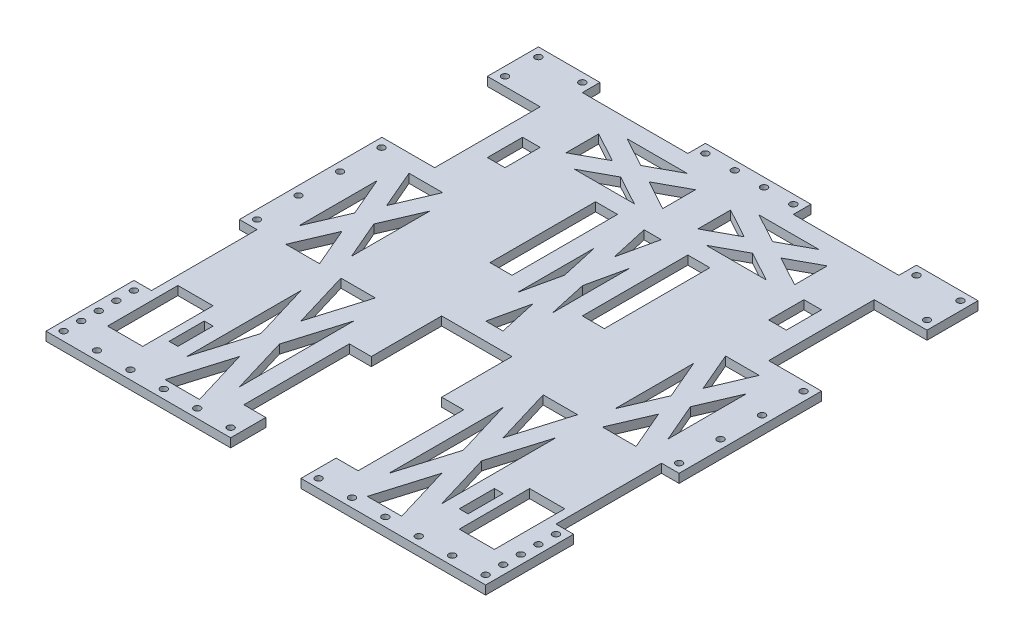
from build123d import *

# Parameters (mm, degrees)
SKETCH1_W           = 317.5
SKETCH1_H           = 355.6
BOSS_EXTRUDE1_DEPTH = 6.35
SKETCH2_W           = 50.8
SKETCH2_H           = 152.4
CUT_EXTRUDE1_DEPTH  = 239.442288615
SKETCH3_W           = 25.4
SKETCH3_H           = 76.2
SKETCH3_W_2         = 12.7
SKETCH3_H_2         = 25.4
CUT_EXTRUDE2_DEPTH  = 239.442288615
SKETCH4_W           = 12.7
SKETCH4_H           = 76.2
SKETCH4_W_2         = 76.2
SKETCH4_H_2         = 12.7
SKETCH4_W_3         = 15.875
CUT_EXTRUDE3_DEPTH  = 239.442288615
SKETCH5_W           = 25.4
SKETCH5_H           = 50.8
SKETCH5_W_2         = 6.35
SKETCH5_H_2         = 25.4
CUT_EXTRUDE4_DEPTH  = 239.442288615
SKETCH7_R           = 2.413
CUT_EXTRUDE6_DEPTH  = 239.442288615


with BuildPart() as part:
    # Sketch1 → Boss-Extrude1 (new body)
    with BuildSketch(Plane(origin=(0, 0, 0), x_dir=(1, 0, 0), z_dir=(0, 1, 0))):
        Rectangle(SKETCH1_W, SKETCH1_H)
    extrude(amount=BOSS_EXTRUDE1_DEPTH)

    # Sketch2 → Cut-Extrude1 (cut, through all)
    with BuildSketch(Plane(origin=(0, 6.35, 0), x_dir=(1, 0, 0), z_dir=(0, 1, 0))):
        with Locations((0, -101.6)):
            Rectangle(SKETCH2_W, SKETCH2_H)
    extrude(amount=-CUT_EXTRUDE1_DEPTH, mode=Mode.SUBTRACT)

    # Sketch3 → Cut-Extrude2 (cut, through all)
    with BuildSketch(Plane(origin=(0, 6.35, 0), x_dir=(1, 0, 0), z_dir=(0, 1, 0))):
        with Locations((133.35, 102.87)):
            Rectangle(SKETCH3_W, SKETCH3_H)
        with Locations((101.6, 102.87)):
            Rectangle(SKETCH3_W_2, SKETCH3_H_2)
        with Locations((-101.6, 102.87)):
            Rectangle(SKETCH3_W_2, SKETCH3_H_2)
        with Locations((-133.35, 102.87)):
            Rectangle(SKETCH3_W, SKETCH3_H)
    extrude(amount=-CUT_EXTRUDE2_DEPTH, mode=Mode.SUBTRACT)

    # Sketch4 → Cut-Extrude3 (cut, through all)
    with BuildSketch(Plane(origin=(0, 6.35, 0), x_dir=(1, 0, 0), z_dir=(0, 1, 0))):
        with Locations((-152.4, 102.87)):
            Rectangle(SKETCH4_W, SKETCH4_H)
        with Locations((-152.4, -76.2)):
            Rectangle(SKETCH4_W, SKETCH4_H)
        with Locations((152.4, 102.87)):
            Rectangle(SKETCH4_W, SKETCH4_H)
        with Locations((152.4, -76.2)):
            Rectangle(SKETCH4_W, SKETCH4_H)
        with Locations((76.2, 171.45)):
            Rectangle(SKETCH4_W_2, SKETCH4_H_2)
        with Locations((-76.2, 171.45)):
            Rectangle(SKETCH4_W_2, SKETCH4_H_2)
        with Locations((-33.3375, -114.3)):
            Rectangle(SKETCH4_W_3, SKETCH4_H)
        with Locations((33.3375, 63.5)):
            Rectangle(SKETCH4_W_3, SKETCH4_H)
        with Locations((-33.3375, 63.5)):
            Rectangle(SKETCH4_W_3, SKETCH4_H)
        with Locations((33.3375, -114.3)):
            Rectangle(SKETCH4_W_3, SKETCH4_H)
    extrude(amount=-CUT_EXTRUDE3_DEPTH, mode=Mode.SUBTRACT)

    # Sketch5 → Cut-Extrude4 (cut, through all)
    with BuildSketch(Plane(origin=(0, 6.35, 0), x_dir=(1, 0, 0), z_dir=(0, 1, 0))):
        Polygon((-73.025, -123.698648777), (-85.445405367, -165.1), (-60.604594633, -165.1), align=None)
        Polygon((-92.075, -60.198648777), (-92.075, -143.001351223), (-79.654594633, -101.6), align=None)
        Polygon((-53.975, -60.198648777), (-66.395405367, -101.6), (-53.975, -143.001351223), align=None)
        Polygon((-85.445405367, -38.1), (-73.025, -79.501351223), (-60.604594633, -38.1), align=None)
        Polygon((-114.3, -8.500053074), (-126.441405825, -36.83), (-102.158594175, -36.83), align=None)
        Polygon((-133.35, 35.949946926), (-133.35, -20.709946926), (-121.208594175, 7.62), align=None)
        Polygon((-95.25, 35.949946926), (-107.391405825, 7.62), (-95.25, -20.709946926), align=None)
        Polygon((-126.441405825, 52.07), (-114.3, 23.740053074), (-102.158594175, 52.07), align=None)
        Polygon((-47.625, 126.116793459), (-69.289121342, 114.3), (-25.960878658, 114.3), align=None)
        Polygon((-82.55, 145.166793459), (-82.55, 121.533206541), (-60.885878658, 133.35), align=None)
        Polygon((-12.7, 145.166793459), (-34.364121342, 133.35), (-12.7, 121.533206541), align=None)
        Polygon((-69.289121342, 152.4), (-47.625, 140.583206541), (-25.960878658, 152.4), align=None)
        Polygon((0, 15.177946348), (-6.195099188, -12.7), (6.195099188, -12.7), align=None)
        Polygon((-12.7, 72.327946348), (-12.7, 16.572053652), (-6.504900812, 44.45), align=None)
        Polygon((12.7, 72.327946348), (6.504900812, 44.45), (12.7, 16.572053652), align=None)
        Polygon((-6.195099188, 101.6), (0, 73.722053652), (6.195099188, 101.6), align=None)
        with Locations((-127, -127)):
            Rectangle(SKETCH5_W, SKETCH5_H)
        with Locations((-104.775, -127)):
            Rectangle(SKETCH5_W_2, SKETCH5_H_2)
    cut_extrude4 = extrude(amount=-CUT_EXTRUDE4_DEPTH, mode=Mode.SUBTRACT)

    # Mirror1: Cut-Extrude4 across plane
    add(cut_extrude4.mirror(Plane(origin=(0, 0, 0), x_dir=(0, 0, 1), z_dir=(1, 0, 0))), mode=Mode.SUBTRACT)

    # Sketch7 → Cut-Extrude6 (cut, through all)
    with BuildSketch(Plane(origin=(0, 6.35, 0), x_dir=(1, 0, 0), z_dir=(0, 1, 0))):
        with Locations((-152.4, -171.45)):
            Circle(SKETCH7_R)
        with Locations((-128.27, -171.45)):
            Circle(SKETCH7_R)
        with Locations((-104.14, -171.45)):
            Circle(SKETCH7_R)
        with Locations((-80.01, -171.45)):
            Circle(SKETCH7_R)
        with Locations((-55.88, -171.45)):
            Circle(SKETCH7_R)
        with Locations((-31.75, -171.45)):
            Circle(SKETCH7_R)
        with Locations((-152.4, -158.75)):
            Circle(SKETCH7_R)
        with Locations((-152.4, -146.05)):
            Circle(SKETCH7_R)
        with Locations((-152.4, -133.35)):
            Circle(SKETCH7_R)
        with Locations((-152.4, -120.65)):
            Circle(SKETCH7_R)
        with Locations((-152.4, -31.75)):
            Circle(SKETCH7_R)
        with Locations((-152.4, -1.778)):
            Circle(SKETCH7_R)
        with Locations((-152.4, 28.194)):
            Circle(SKETCH7_R)
        with Locations((-152.4, 58.166)):
            Circle(SKETCH7_R)
        with Locations((-152.4, 171.45)):
            Circle(SKETCH7_R)
        with Locations((-120.65, 171.45)):
            Circle(SKETCH7_R)
        with Locations((-152.4, 147.32)):
            Circle(SKETCH7_R)
        with Locations((152.4, 147.32)):
            Circle(SKETCH7_R)
        with Locations((120.65, 171.45)):
            Circle(SKETCH7_R)
        with Locations((152.4, 171.45)):
            Circle(SKETCH7_R)
        with Locations((152.4, 58.166)):
            Circle(SKETCH7_R)
        with Locations((152.4, 28.194)):
            Circle(SKETCH7_R)
        with Locations((152.4, -1.778)):
            Circle(SKETCH7_R)
        with Locations((152.4, -31.75)):
            Circle(SKETCH7_R)
        with Locations((152.4, -120.65)):
            Circle(SKETCH7_R)
        with Locations((152.4, -133.35)):
            Circle(SKETCH7_R)
        with Locations((152.4, -146.05)):
            Circle(SKETCH7_R)
        with Locations((152.4, -158.75)):
            Circle(SKETCH7_R)
        with Locations((31.75, -171.45)):
            Circle(SKETCH7_R)
        with Locations((55.88, -171.45)):
            Circle(SKETCH7_R)
        with Locations((80.01, -171.45)):
            Circle(SKETCH7_R)
        with Locations((104.14, -171.45)):
            Circle(SKETCH7_R)
        with Locations((128.27, -171.45)):
            Circle(SKETCH7_R)
        with Locations((152.4, -171.45)):
            Circle(SKETCH7_R)
        with Locations((-31.75, 171.45)):
            Circle(SKETCH7_R)
        with Locations((-10.583333333, 171.45)):
            Circle(SKETCH7_R)
        with Locations((10.583333333, 171.45)):
            Circle(SKETCH7_R)
        with Locations((31.75, 171.45)):
            Circle(SKETCH7_R)
    extrude(amount=-CUT_EXTRUDE6_DEPTH, mode=Mode.SUBTRACT)


solid = part.part
